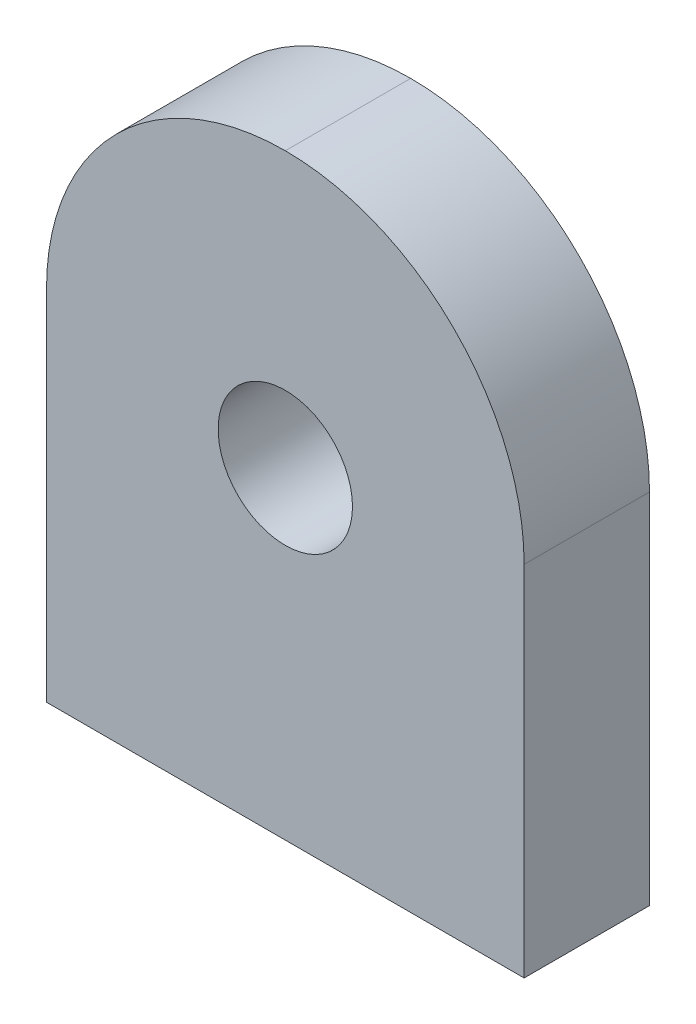
from build123d import *

# Parameters (mm, degrees)
SKETCH1_W           = 16
SKETCH1_H           = 20
BOSS_EXTRUDE1_DEPTH = 4.2
SKETCH2_R           = 2.25
CUT_EXTRUDE1_DEPTH  = 26.954575704
FILLET1_R           = 8


with BuildPart() as part:
    # Sketch1 → Boss-Extrude1 (new body)
    with BuildSketch(Plane.XY):
        with Locations((8, 10)):
            Rectangle(SKETCH1_W, SKETCH1_H)
    extrude(amount=BOSS_EXTRUDE1_DEPTH)

    # Sketch2 → Cut-Extrude1 (cut, through all)
    with BuildSketch(Plane.XY.offset(4.2)):
        with Locations((8, 10.8)):
            Circle(SKETCH2_R)
    extrude(amount=-CUT_EXTRUDE1_DEPTH, mode=Mode.SUBTRACT)

    # Fillet1
    fillet1_edges = [part.edges().sort_by_distance(p)[0] for p in [
        (16, 20, 2.1),
        (0, 20, 2.1),
    ]]
    fillet(fillet1_edges, radius=FILLET1_R - 0.0001)  # a hair under: the kernel refuses the full size


solid = part.part
